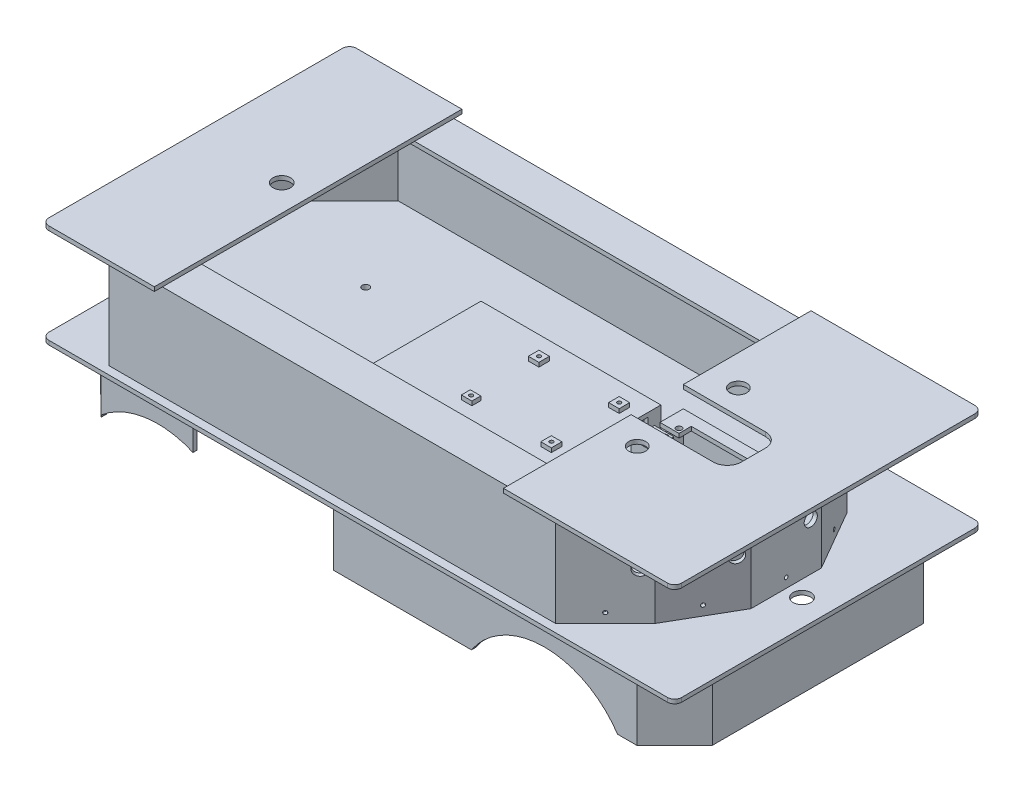
from build123d import *
from build123d.topology import SkipClean

# Parameters (mm, degrees)
SKETCH1_R                             = 2.54
SKETCH1_R_2                           = 6.35
MAINBASEPLATE_DEPTH                   = 3
BASEBOSS_EXTRUDE2_START               = 10.16
SKETCH2_R                             = 6.096
SKETCH2_R_2                           = 2.54
BASEBOSS_EXTRUDE2_DEPTH               = 10.16
DRIVE_BATTERYBOSS_EXTRUDE1_DEPTH      = 28.575
SKETCH4_W                             = 155.4
SKETCH4_H                             = 56.8
DRIVE_BATTERY_CAPBOSS_EXTRUDE2_DEPTH  = 3
DRIVE_BATTERYCUTOUTCUT_EXTRUDE1_DEPTH = 31.575
PIBATTERYBOXBOSS_EXTRUDE3_DEPTH       = 25.4
SKETCH7_W                             = 130
SKETCH7_H                             = 82.2
PIBATTERYTOPBOSS_EXTRUDE4_DEPTH       = 3
SKETCH8_W                             = 63.5
SKETCH8_H                             = 25.4
PIBATTERYWIRESCUT_EXTRUDE2_DEPTH      = 13.16
SKETCH9_W                             = 7.62
SKETCH9_H                             = 7.62
SKETCH9_R                             = 1.35
SKETCH9_H_2                           = 6.437586206
PIBOARDBOSS_EXTRUDE5_DEPTH            = 3
PANTILT_EXTRUDE6_DEPTH                = 53.34
SKETCH11_W                            = 69.5
SKETCH11_H                            = 37.75
BOSS_EXTRUDE7_DEPTH                   = 3
SKETCH12_R                            = 2.0193
CUT_EXTRUDE3_DEPTH                    = 56.34
BOTTOM_SHELL_WALLSBOSS_EXTRUDE8_DEPTH = 68.58
SKETCH14_R                            = 1.35255
SKETCH14_R_2                          = 4.7625
SHARP1CUT_EXTRUDE4_DEPTH              = 12.7
SKETCH15_R                            = 1.35255
SKETCH15_R_2                          = 4.7625
SHARP2CUT_EXTRUDE5_DEPTH              = 7.62
SKETCH16_R                            = 1.35255
SKETCH16_R_2                          = 4.7625
SHARP3CUT_EXTRUDE6_DEPTH              = 7.62
SKETCH17_R                            = 1.35255
SKETCH17_R_2                          = 4.7625
SHARPCUT_EXTRUDE7_DEPTH               = 7.62
SKETCH18_R                            = 1.35255
SKETCH18_R_2                          = 4.7625
SHARPCUT_EXTRUDE8_DEPTH               = 7.62
TOPSENSORPLATEBOSS_EXTRUDE8_DEPTH     = 3
TOPSENSORPLATECUT_EXTRUDE4_START      = -8.08
SKETCH21_R                            = 6.096
TOPSENSORPLATECUT_EXTRUDE4_DEPTH      = 8.08
FRONTROCKERPANBOSS_EXTRUDE9_DEPTH     = 45.72
SKETCH23_R                            = 63.5
TIRECUT_EXTRUDE5_DEPTH                = 25.4
SKETCH24_R                            = 10.9855
CUT_EXTRUDE6_DEPTH                    = 7.62
REARTOPDECKBOSS_EXTRUDE10_DEPTH       = 3
TIRECUT_EXTRUDE8_START                = -35.56
TIRECUT_EXTRUDE8_DEPTH                = 35.56
SKETCH30_R                            = 6.35
CUT_EXTRUDE10_DEPTH                   = 11.684
BOSS_EXTRUDE8_DEPTH                   = 134.62
BOSS_EXTRUDE8_DEPTH_BACK              = 180.34
SKETCH31_W                            = 25.4
SKETCH31_H                            = 3


with BuildPart() as part:
    # Sketch1 → mainbaseplate (new body)
    with BuildSketch(Plane(origin=(0, 0, 0), x_dir=(1, 0, 0), z_dir=(0, 1, 0))):
        with BuildLine():
            Line((-223.52, -111.125), (223.52, -111.125))
            ThreePointArc((223.52, -111.125), (227.112102448, -109.637102448), (228.6, -106.045))
            Line((228.6, -106.045), (228.6, 106.045))
            ThreePointArc((228.6, 106.045), (227.112102448, 109.637102448), (223.52, 111.125))
            Line((223.52, 111.125), (-223.52, 111.125))
            ThreePointArc((-223.52, 111.125), (-227.112102448, 109.637102448), (-228.6, 106.045))
            Line((-228.6, 106.045), (-228.6, -106.045))
            ThreePointArc((-228.6, -106.045), (-227.112102448, -109.637102448), (-223.52, -111.125))
        make_face()
        with Locations(Location((127, 36.5125, 0), (0, 0, 270))):
            Circle(SKETCH1_R, mode=Mode.SUBTRACT)
        with Locations(Location((127, -36.5125, 0), (0, 0, 270))):
            Circle(SKETCH1_R, mode=Mode.SUBTRACT)
        with Locations(Location((-142.24, 36.5125, 0), (0, 0, 270))):
            Circle(SKETCH1_R, mode=Mode.SUBTRACT)
        with Locations(Location((-142.24, -36.5125, 0), (0, 0, 270))):
            Circle(SKETCH1_R, mode=Mode.SUBTRACT)
        with Locations(Location((209.55, 0, 0), (0, 0, 270))):
            Circle(SKETCH1_R_2, mode=Mode.SUBTRACT)
    extrude(amount=MAINBASEPLATE_DEPTH)

    # Sketch2 → BaseBoss-Extrude2 (add)
    # profile 1 of 4: a face of its own
    with SkipClean():  # the faces are left unmerged after this step: merging them gives an invalid solid
        with BuildSketch(Plane.XZ.offset(BASEBOSS_EXTRUDE2_START)):
            with Locations(Location((127, 36.5125, 0), (0, 0, 270))):
                Circle(SKETCH2_R)
            with Locations(Location((127, 36.5125, 0), (0, 0, 270))):
                Circle(SKETCH2_R_2, mode=Mode.SUBTRACT)
        # profile 2 of 4: a face of its own
        with BuildSketch(Plane.XZ.offset(BASEBOSS_EXTRUDE2_START)):
            with Locations(Location((127, -36.5125, 0), (0, 0, 270))):
                Circle(SKETCH2_R)
            with Locations(Location((127, -36.5125, 0), (0, 0, 270))):
                Circle(SKETCH2_R_2, mode=Mode.SUBTRACT)
        # profile 3 of 4: a face of its own
        with BuildSketch(Plane.XZ.offset(BASEBOSS_EXTRUDE2_START)):
            with Locations(Location((-142.24, -36.5125, 0), (0, 0, 270))):
                Circle(SKETCH2_R)
            with Locations(Location((-142.24, -36.5125, 0), (0, 0, 270))):
                Circle(SKETCH2_R_2, mode=Mode.SUBTRACT)
        # profile 4 of 4: a face of its own
        with BuildSketch(Plane.XZ.offset(BASEBOSS_EXTRUDE2_START)):
            with Locations(Location((-142.24, 36.5125, 0), (0, 0, 270))):
                Circle(SKETCH2_R)
            with Locations(Location((-142.24, 36.5125, 0), (0, 0, 270))):
                Circle(SKETCH2_R_2, mode=Mode.SUBTRACT)
        extrude(amount=-BASEBOSS_EXTRUDE2_DEPTH)

    # Sketch3 → Drive BatteryBoss-Extrude1 (add)
    with SkipClean():  # the faces are left unmerged after this step: merging them gives an invalid solid
        with BuildSketch(Plane.XZ):
            Polygon((-228.6, 28.4), (-73.2, 28.4), (-73.2, -28.4), (-228.6, -28.4), (-228.6, -25.4), (-76.2, -25.4), (-76.2, 25.4), (-228.6, 25.4), align=None)
        extrude(amount=DRIVE_BATTERYBOSS_EXTRUDE1_DEPTH)

    # Sketch4 → drive Battery CapBoss-Extrude2 (add)
    with SkipClean():  # the faces are left unmerged after this step: merging them gives an invalid solid
        with BuildSketch(Plane.XZ.offset(28.575)):
            with Locations((-150.9, 0)):
                Rectangle(SKETCH4_W, SKETCH4_H)
        extrude(amount=DRIVE_BATTERY_CAPBOSS_EXTRUDE2_DEPTH)

    # Sketch5 → Drive batterycutoutCut-Extrude1 (cut)
    with SkipClean():  # the faces are left unmerged after this step: merging them gives an invalid solid
        with BuildSketch(Plane.XZ.offset(31.575)):
            Polygon((-98.6, -28.4), (-73.2, -3), (-52.147358369, -3), (-52.147358369, -43.637330017), (-98.6, -43.637330017), align=None)
        extrude(amount=-DRIVE_BATTERYCUTOUTCUT_EXTRUDE1_DEPTH, mode=Mode.SUBTRACT)

    # Sketch6 → PiBatteryBoxBoss-Extrude3 (add)
    with SkipClean():  # the faces are left unmerged after this step: merging them gives an invalid solid
        with BuildSketch(Plane(origin=(0, 3, 0), x_dir=(1, 0, 0), z_dir=(0, 1, 0))):
            Polygon((-63.5, -41.1), (66.5, -41.1), (66.5, 41.1), (-63.5, 41.1), (-63.5, 38.1), (63.5, 38.1), (63.5, -38.1), (-63.5, -38.1), align=None)
        extrude(amount=PIBATTERYBOXBOSS_EXTRUDE3_DEPTH)

    # Sketch7 → PibatterytopBoss-Extrude4 (add)
    with SkipClean():  # the faces are left unmerged after this step: merging them gives an invalid solid
        with BuildSketch(Plane(origin=(0, 28.4, 0), x_dir=(1, 0, 0), z_dir=(0, 1, 0))):
            with Locations((1.5, 0)):
                Rectangle(SKETCH7_W, SKETCH7_H)
        extrude(amount=PIBATTERYTOPBOSS_EXTRUDE4_DEPTH)

    # Sketch8 → pibatterywiresCut-Extrude2 (cut)
    with SkipClean():  # the faces are left unmerged after this step: merging them gives an invalid solid
        with BuildSketch(Plane(origin=(66.5, 0, 0), x_dir=(0, 0, -1), z_dir=(1, 0, 0))):
            with Locations((0, 15.7)):
                Rectangle(SKETCH8_W, SKETCH8_H)
        extrude(amount=-PIBATTERYWIRESCUT_EXTRUDE2_DEPTH, mode=Mode.SUBTRACT)

    # Sketch9 → PiBoardBoss-Extrude5 (add)
    # profile 1 of 4: a face of its own
    with SkipClean():  # the faces are left unmerged after this step: merging them gives an invalid solid
        with BuildSketch(Plane(origin=(0, 31.4, 0), x_dir=(1, 0, 0), z_dir=(0, 1, 0))):
            with Locations((52.92, 24.511)):
                Rectangle(SKETCH9_W, SKETCH9_H)
            with Locations(Location((52.92, 24.511, 0), (0, 0, 270))):
                Circle(SKETCH9_R, mode=Mode.SUBTRACT)
        # profile 2 of 4: a face of its own
        with BuildSketch(Plane(origin=(0, 31.4, 0), x_dir=(1, 0, 0), z_dir=(0, 1, 0))):
            with Locations((52.92, -24.489)):
                Rectangle(SKETCH9_W, SKETCH9_H)
            with Locations(Location((52.92, -24.489, 0), (0, 0, 270))):
                Circle(SKETCH9_R, mode=Mode.SUBTRACT)
        # profile 3 of 4: a face of its own
        with BuildSketch(Plane(origin=(0, 31.4, 0), x_dir=(1, 0, 0), z_dir=(0, 1, 0))):
            with Locations((-5.08, 24.511)):
                Rectangle(SKETCH9_W, SKETCH9_H)
            with Locations(Location((-5.08, 24.511, 0), (0, 0, 270))):
                Circle(SKETCH9_R, mode=Mode.SUBTRACT)
        # profile 4 of 4: a face of its own
        with BuildSketch(Plane(origin=(0, 31.4, 0), x_dir=(1, 0, 0), z_dir=(0, 1, 0))):
            with Locations((-5.08, -24.489)):
                Rectangle(SKETCH9_W, SKETCH9_H_2)
            with Locations(Location((-5.08, -24.489, 0), (0, 0, 270))):
                Circle(SKETCH9_R, mode=Mode.SUBTRACT)
        extrude(amount=PIBOARDBOSS_EXTRUDE5_DEPTH)

    # Sketch10 → PanTilt-Extrude6 (add)
    with SkipClean():  # the faces are left unmerged after this step: merging them gives an invalid solid
        with BuildSketch(Plane(origin=(0, 3, 0), x_dir=(1, 0, 0), z_dir=(0, 1, 0))):
            Polygon((104.95, 18.875), (174.45, 18.875), (174.45, -18.875), (104.95, -18.875), (104.95, -6.175), (107.95, -6.175), (107.95, -15.875), (171.45, -15.875), (171.45, 15.875), (107.95, 15.875), (107.95, 6.175), (104.95, 6.175), align=None)
        extrude(amount=PANTILT_EXTRUDE6_DEPTH)

    # Sketch11 → Boss-Extrude7 (add)
    with SkipClean():  # the faces are left unmerged after this step: merging them gives an invalid solid
        with BuildSketch(Plane(origin=(0, 56.34, 0), x_dir=(1, 0, 0), z_dir=(0, 1, 0))):
            with Locations((139.7, 0)):
                Rectangle(SKETCH11_W, SKETCH11_H)
        extrude(amount=BOSS_EXTRUDE7_DEPTH)

    # Sketch12 → Cut-Extrude3 (cut)
    with SkipClean():  # the faces are left unmerged after this step: merging them gives an invalid solid
        with BuildSketch(Plane(origin=(0, 59.34, 0), x_dir=(1, 0, 0), z_dir=(0, 1, 0))):
            with Locations(Location((163.83, 5.08, 0), (0, 0, 270))):
                Circle(SKETCH12_R)
            with Locations(Location((163.83, -5.08, 0), (0, 0, 270))):
                Circle(SKETCH12_R)
            with Locations(Location((115.57, 5.08, 0), (0, 0, 270))):
                Circle(SKETCH12_R)
            with Locations(Location((115.57, -5.08, 0), (0, 0, 270))):
                Circle(SKETCH12_R)
            Polygon((118.745, 1.937698292), (104.95, 1.937698292), (95.841621454, 0), (104.95, -1.990085687), (118.745, -1.990085687), (118.745, -10.795), (160.655, -10.795), (160.655, 10.795), (118.745, 10.795), align=None)
        extrude(amount=-CUT_EXTRUDE3_DEPTH, mode=Mode.SUBTRACT)

    # Sketch13 → Bottom Shell WallsBoss-Extrude8 (add)
    with SkipClean():  # the faces are left unmerged after this step: merging them gives an invalid solid
        with BuildSketch(Plane(origin=(0, 3, 0), x_dir=(1, 0, 0), z_dir=(0, 1, 0))):
            Polygon((198.12, 0), (198.12, 25.4), (172.72, 69.394090512), (136.798975516, 105.315114997), (-185.781024484, 105.315114997), (-221.702048969, 69.394090512), (-221.702048969, 0), (-221.702048969, -69.394090512), (-185.781024484, -105.315114997), (136.798975516, -105.315114997), (172.72, -69.394090512), (198.12, -25.4), align=None)
            Polygon((195.12, 0), (195.12, 24.596152423), (170.319402535, 67.55204729), (135.556334829, 102.315114997), (-184.538383797, 102.315114997), (-218.702048969, 68.151449825), (-218.702048969, 0), (-218.702048969, -68.151449825), (-184.538383797, -102.315114997), (135.556334829, -102.315114997), (170.319402535, -67.55204729), (195.12, -24.596152423), align=None, mode=Mode.SUBTRACT)
        extrude(amount=BOTTOM_SHELL_WALLSBOSS_EXTRUDE8_DEPTH)
    add(part.part.scale(1), mode=Mode.REPLACE)  # the faces are merged on a copy

    # Sketch14 → Sharp1Cut-Extrude4 (cut)
    with BuildSketch(Plane(origin=(121.057045256, 0, -121.057045256), x_dir=(-0.7071067811865495, 0, -0.7071067811865457), z_dir=(0.7071067811865457, 0, -0.7071067811865495))):
        with Locations((-47.662451271, 64.722)):
            Circle(SKETCH14_R)
        with Locations((-47.662451271, 9.858)):
            Circle(SKETCH14_R)
        with Locations((-29.882451271, 37.29)):
            Circle(SKETCH14_R_2)
    extrude(amount=-SHARP1CUT_EXTRUDE4_DEPTH, mode=Mode.SUBTRACT)

    # Sketch15 → Sharp2Cut-Extrude5 (cut)
    with BuildSketch(Plane(origin=(159.588522628, 0, -92.138476499), x_dir=(-0.5000000000000009, 0, -0.8660254037844383), z_dir=(0.8660254037844382, 0, -0.5000000000000008))):
        with Locations((-51.662954744, 64.722)):
            Circle(SKETCH15_R)
        with Locations((-51.662954744, 9.858)):
            Circle(SKETCH15_R)
        with Locations((-33.882954744, 37.29)):
            Circle(SKETCH15_R_2)
    extrude(amount=-SHARP2CUT_EXTRUDE5_DEPTH, mode=Mode.SUBTRACT)

    # Sketch16 → Sharp3Cut-Extrude6 (cut)
    with BuildSketch(Plane(origin=(198.12, 0, 0), x_dir=(0, 0, -1), z_dir=(1, 0, 0))):
        with Locations((0, 64.722)):
            Circle(SKETCH16_R)
        with Locations((0, 9.858)):
            Circle(SKETCH16_R)
        with Locations((17.78, 37.29)):
            Circle(SKETCH16_R_2)
    extrude(amount=-SHARP3CUT_EXTRUDE6_DEPTH, mode=Mode.SUBTRACT)

    # Sketch17 → SharpCut-Extrude7 (cut)
    with BuildSketch(Plane(origin=(159.588522628, 0, 92.138476499), x_dir=(0.5000000000000009, 0, -0.8660254037844383), z_dir=(0.8660254037844382, 0, 0.5000000000000008))):
        with Locations((51.662954744, 64.722)):
            Circle(SKETCH17_R)
        with Locations((51.662954744, 9.858)):
            Circle(SKETCH17_R)
        with Locations((69.442954744, 37.29)):
            Circle(SKETCH17_R_2)
    extrude(amount=-SHARPCUT_EXTRUDE7_DEPTH, mode=Mode.SUBTRACT)

    # Sketch18 → SharpCut-Extrude8 (cut)
    with BuildSketch(Plane(origin=(121.057045256, 0, 121.057045256), x_dir=(0.7071067811865492, 0, -0.7071067811865458), z_dir=(0.7071067811865458, 0, 0.7071067811865492))):
        with Locations((47.662451271, 64.722)):
            Circle(SKETCH18_R)
        with Locations((47.662451271, 9.858)):
            Circle(SKETCH18_R)
        with Locations((65.442451271, 37.29)):
            Circle(SKETCH18_R_2)
    extrude(amount=-SHARPCUT_EXTRUDE8_DEPTH, mode=Mode.SUBTRACT)

    # Sketch19 → TopSensorplateBoss-Extrude8 (add)
    with BuildSketch(Plane(origin=(0, 71.58, 0), x_dir=(1, 0, 0), z_dir=(0, 1, 0))):
        with BuildLine():
            Line((104.95, -111.125), (223.52, -111.125))
            ThreePointArc((223.52, -111.125), (227.112102448, -109.637102448), (228.6, -106.045))
            Line((228.6, -106.045), (228.6, 106.045))
            ThreePointArc((228.6, 106.045), (227.112102448, 109.637102448), (223.52, 111.125))
            Line((223.52, 111.125), (104.95, 111.125))
            Line((104.95, 111.125), (104.95, -111.125))
        make_face()
    extrude(amount=TOPSENSORPLATEBOSS_EXTRUDE8_DEPTH)

    # Sketch21 → topsensorplateCut-Extrude4 (cut)
    with BuildSketch(Plane(origin=(0, 74.58, 0), x_dir=(1, 0, 0), z_dir=(0, 1, 0)).offset(TOPSENSORPLATECUT_EXTRUDE4_START)):
        with Locations(Location((127, -36.5125, 0), (0, 0, 90))):
            Circle(SKETCH21_R)
        with Locations(Location((127, 36.5125, 0), (0, 0, 90))):
            Circle(SKETCH21_R)
        with BuildLine():
            Line((104.95, -18.875), (164.29, -18.875))
            ThreePointArc((164.29, -18.875), (171.474204897, -15.899204897), (174.45, -8.715))
            Line((174.45, -8.715), (174.45, 8.715))
            ThreePointArc((174.45, 8.715), (171.474204897, 15.899204897), (164.29, 18.875))
            Line((164.29, 18.875), (104.95, 18.875))
            Line((104.95, 18.875), (84.846229557, 2.282528415))
            Line((84.846229557, 2.282528415), (104.95, -18.875))
        make_face()
    extrude(amount=TOPSENSORPLATECUT_EXTRUDE4_DEPTH, mode=Mode.SUBTRACT)

    # Sketch22 → frontrockerpanBoss-Extrude9 (add)
    with BuildSketch(Plane.XZ):
        Polygon((220.98, 0), (220.98, 76.2), (193.675, 103.505), (-25.4, 103.505), (-25.4, 100.505), (192.432359313, 100.505), (217.98, 74.957359313), (217.98, 0), (217.98, -74.957359313), (192.432359313, -100.505), (-25.4, -100.505), (-25.4, -103.505), (193.675, -103.505), (220.98, -76.2), align=None)
        Polygon((-220.98, 28.4), (-220.98, 76.2), (-193.548, 103.505), (-127, 103.505), (-127, 100.505), (-192.309434749, 100.505), (-217.98, 74.953279958), (-217.98, 28.4), align=None)
        Polygon((-127, -103.505), (-127, -100.505), (-192.309434749, -100.505), (-217.98, -74.953279958), (-217.98, -28.4), (-220.98, -28.4), (-220.98, -76.2), (-193.548, -103.505), align=None)
    extrude(amount=FRONTROCKERPANBOSS_EXTRUDE9_DEPTH)

    # Sketch23 → TireCut-Extrude5 (cut)
    with BuildSketch(Plane(origin=(0, 0, -103.505), x_dir=(-1, 0, 0), z_dir=(0, 0, -1))):
        with Locations((-127, -81.005238028)):
            Circle(SKETCH23_R)
        with Locations((152.4, -81.005238028)):
            Circle(SKETCH23_R)
    extrude(amount=-TIRECUT_EXTRUDE5_DEPTH, mode=Mode.SUBTRACT)

    # Sketch24 → Cut-Extrude6 (cut)
    with BuildSketch(Plane.ZY.offset(221.702048969)):
        with Locations((0, 37.29)):
            Circle(SKETCH24_R)
    extrude(amount=-CUT_EXTRUDE6_DEPTH, mode=Mode.SUBTRACT)

    # Sketch25 → ReartopdeckBoss-Extrude10 (add)
    with BuildSketch(Plane(origin=(0, 71.58, 0), x_dir=(1, 0, 0), z_dir=(0, 1, 0))):
        with BuildLine():
            Line((-223.52, -111.125), (-147.32, -111.125))
            Line((-147.32, -111.125), (-147.32, 111.125))
            Line((-147.32, 111.125), (-223.52, 111.125))
            ThreePointArc((-223.52, 111.125), (-227.112102448, 109.637102448), (-228.6, 106.045))
            Line((-228.6, 106.045), (-228.6, -106.045))
            ThreePointArc((-228.6, -106.045), (-227.112102448, -109.637102448), (-223.52, -111.125))
        make_face()
    extrude(amount=REARTOPDECKBOSS_EXTRUDE10_DEPTH)

    # Sketch28 → TireCut-Extrude8 (cut)
    with BuildSketch(Plane.XY.offset(103.505).offset(TIRECUT_EXTRUDE8_START)):
        with BuildLine():
            Line((-205.193957773, -45.72), (-93.139892563, -108.478222331))
            Line((-93.139892563, -108.478222331), (179.793957773, -45.72))
            ThreePointArc((179.793957773, -45.72), (127, -17.505238028), (74.206042227, -45.72))
            Line((74.206042227, -45.72), (-102.045784785, -69.746732425))
            Line((-102.045784785, -69.746732425), (-127, -22.806526702))
            ThreePointArc((-127, -22.806526702), (-160.886704277, -18.074912663), (-192.309434749, -31.614074668))
            ThreePointArc((-192.309434749, -31.614074668), (-199.285221857, -38.179708593), (-205.193957773, -45.72))
        make_face()
    extrude(amount=TIRECUT_EXTRUDE8_DEPTH, mode=Mode.SUBTRACT)

    # Sketch30 → Cut-Extrude10 (cut)
    with BuildSketch(Plane(origin=(0, 74.58, 0), x_dir=(1, 0, 0), z_dir=(0, 1, 0))):
        with Locations(Location((-166.37, 0, 0), (0, 0, 270))):
            Circle(SKETCH30_R)
    extrude(amount=-CUT_EXTRUDE10_DEPTH, mode=Mode.SUBTRACT)

    # Sketch31 → Boss-Extrude8 (add, two sides: drawn at the far end of the back side and taken through both)
    with BuildSketch(Plane(origin=(0, 0, 0), x_dir=(0, 0, -1), z_dir=(1, 0, 0)).offset(-BOSS_EXTRUDE8_DEPTH_BACK)):
        with Locations((-89.615114997, 70.08)):
            Rectangle(SKETCH31_W, SKETCH31_H)
        with Locations((89.615114997, 70.08)):
            Rectangle(SKETCH31_W, SKETCH31_H)
    extrude(amount=BOSS_EXTRUDE8_DEPTH + BOSS_EXTRUDE8_DEPTH_BACK)


solid = part.part
